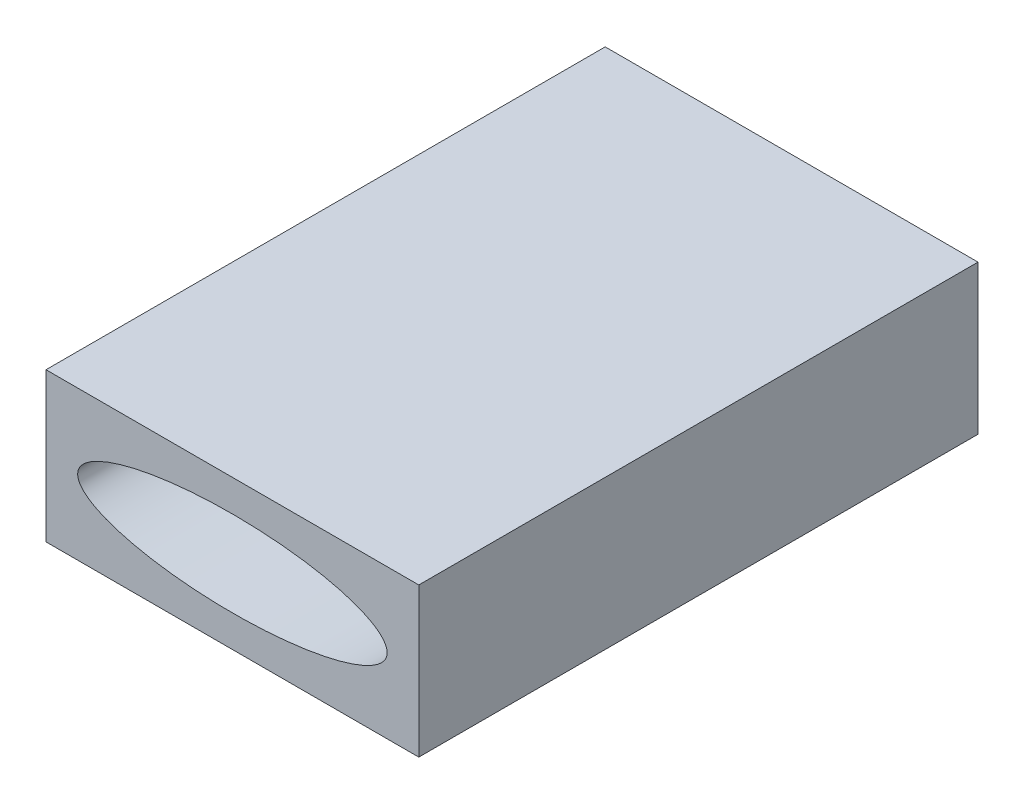
from build123d import *

# Parameters (mm, degrees)
SKETCH_1_W        = 2000
SKETCH_1_H        = 800
SKETCH_1_RX       = 800
SKETCH_1_RY       = 200
EXTRUDE_435_DEPTH = 3000
OTHER_START       = -3000
OTHER_1_DEPTH     = 3000


# Read off the part's stored shape, not the designer's step: Полость1
with BuildPart() as part:
    # Эскиз1 → Extrude 435 (new body)
    with BuildSketch(Plane.XY):
        with Locations((1000, 400)):
            Rectangle(SKETCH_1_W, SKETCH_1_H)
        with Locations((1000, 400)):
            Ellipse(SKETCH_1_RX, SKETCH_1_RY, mode=Mode.SUBTRACT)
    extrude(amount=-EXTRUDE_435_DEPTH)

    # Полость1 outline → Полость1 (cut)
    with BuildSketch(Plane.XY.offset(OTHER_START)):
        with BuildLine():
            add(Edge.make_bspline(
                [(170, 400), (170, 1.628314259), (1415, 200.81415713), (2660, 400), (1415, 599.18584287), (170, 798.371685741), (170, 400)],
                knots=[0, 0, 0, 2.094395102, 2.094395102, 4.188790205, 4.188790205, 6.283185307, 6.283185307, 6.283185307], degree=2, weights=[1, 0.5, 1, 0.5, 1, 0.5, 1]))
        make_face()
        with BuildLine():
            add(Edge.make_bspline(
                [(1800, 400), (1800, 746.410161514), (600, 573.205080757), (-600, 400), (600, 226.794919243), (1800, 53.589838486), (1800, 400)],
                knots=[0, 0, 0, 2.094395102, 2.094395102, 4.188790205, 4.188790205, 6.283185307, 6.283185307, 6.283185307], degree=2, weights=[1, 0.5, 1, 0.5, 1, 0.5, 1]))
        make_face(mode=Mode.SUBTRACT)
    extrude(amount=OTHER_1_DEPTH, mode=Mode.SUBTRACT)


solid = part.part
